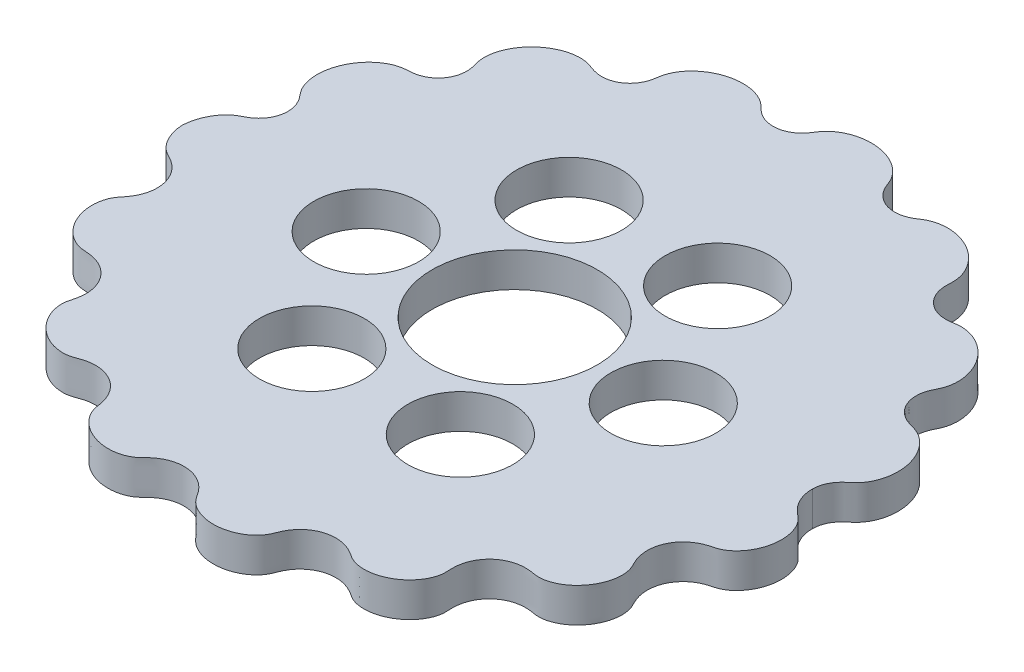
from build123d import *

# Parameters (mm, degrees)
CYCLOID_OUTLINE_R  = 12
CYCLOID_DEPTH      = 5
SKETCH9_R          = 7.62
CUT_EXTRUDE1_DEPTH = 70.412355435
OUTPUT_DRIVE_COUNT = 6


# Read off the part's stored shape, not the designer's step: cycloid
with BuildPart() as part:
    # cycloid outline → cycloid (new body)
    with BuildSketch(Plane(origin=(0, 0, 0), x_dir=(1, 0, 0), z_dir=(0, 1, 0))):
        with BuildLine():
            add(Edge.make_bspline(
                [(45.791143645, 0), (45.791044718, 0.035709067), (45.7917454, 0.091380476), (45.794361576, 0.182354533), (45.801877903, 0.319247109), (45.813231744, 0.451329802), (45.837194549, 0.642311191), (45.883740937, 0.900285738), (45.959121997, 1.195092859), (46.073392075, 1.524082435), (46.214825918, 1.842142476), (46.382081831, 2.147509859), (46.582505228, 2.451369448), (46.817612558, 2.750117995), (47.088232695, 3.039069345), (47.392300372, 3.317072034), (47.711650736, 3.576311705), (48.027967915, 3.839897493), (48.320841153, 4.129895992), (48.58665081, 4.444601084), (48.951399339, 4.95853426), (49.348576064, 5.71131862), (49.689762772, 6.727902698), (49.869417698, 8.005562584), (49.829972691, 9.246302695), (49.605704189, 10.417026119), (49.226622231, 11.495620562), (48.719669318, 12.466273191), (48.132222558, 13.270609136), (47.507180263, 13.911316119), (46.8808133, 14.401316598), (46.283614962, 14.756429936), (45.654719007, 15.020096062), (45.008969684, 15.174530662), (44.234761979, 15.402350458), (43.409252953, 15.8101144), (42.603395572, 16.482899511), (41.92645361, 17.493052272), (41.611196772, 18.50643566), (41.562738703, 19.44125351), (41.677366358, 20.18580286), (41.825605186, 20.696812098), (42.00265135, 21.135976255), (42.183918168, 21.509479821), (42.373360768, 21.878649615), (42.537443841, 22.260597058), (42.6655117, 22.655905781), (42.758985977, 23.060757489), (42.849842198, 23.676452052), (42.868905325, 24.507957446), (42.734142934, 25.540367974), (42.358867515, 26.730692622), (41.714976005, 27.997266086), (40.735039603, 29.260123841), (39.544875878, 30.245130523), (38.334912277, 30.855269674), (37.385546328, 31.134482617), (36.764100744, 31.239847338), (36.261122259, 31.27509466), (35.756618447, 31.257577158), (35.25840933, 31.181698295), (34.710386168, 31.088969133), (34.102125273, 31.044960795), (33.440153627, 31.087579768), (32.742765523, 31.252147132), (31.986481889, 31.574497619), (31.223605761, 32.108663374), (30.621752456, 32.800122521), (30.209550937, 33.593094839), (29.99181102, 34.327693461), (29.901841056, 34.963585281), (29.895682679, 35.62016809), (29.950101814, 36.28926429), (29.90707186, 36.977135893), (29.757972908, 37.664610893), (29.488647425, 38.422039871), (29.070419178, 39.225063385), (28.319934271, 40.26665126), (27.260260577, 41.242558266), (25.986370485, 42.016592634), (24.538812039, 42.527749499), (23.248352435, 42.743556926), (22.165810427, 42.720926624), (21.32642594, 42.564532639), (20.732315245, 42.370333258), (20.364365996, 42.21576588), (20.010858901, 42.030150625), (19.674617348, 41.815600126), (19.342479261, 41.595242791), (18.999155619, 41.391800088), (18.580987376, 41.184272563), (18.079096496, 40.997869123), (17.325688462, 40.828104465), (16.293627847, 40.819534903), (15.281758203, 41.100410913), (14.387736961, 41.65300335), (13.735964487, 42.297412034), (13.28985743, 42.928000082), (12.990493463, 43.5598319), (12.781474443, 44.148027847), (12.516068415, 44.71411016), (12.120084494, 45.343040797), (11.473988999, 46.063848156), (10.527769823, 46.785797808), (9.359701664, 47.370620769), (8.158950449, 47.729195176), (6.969488339, 47.886227379), (5.822922308, 47.865537325), (4.742364093, 47.689958888), (3.814520336, 47.392420218), (3.045616929, 47.023402249), (2.430665343, 46.627741452), (1.955464495, 46.243966915), (1.575671148, 45.853986374), (1.284809553, 45.475990371), (1.015548053, 45.060734846), (0.737655941, 44.628571167), (0.36381858, 44.157464682), (-0.218685603, 43.613854923), (-0.991222304, 43.13385172), (-1.855807766, 42.848037912), (-2.756661373, 42.774991225), (-3.539268391, 42.869190961), (-4.188453233, 43.05813635), (-4.737468758, 43.319195639), (-5.188923315, 43.613514971), (-5.554377122, 43.909610961), (-5.848423443, 44.184347472), (-6.131330185, 44.469984176), (-6.426996975, 44.743204379), (-6.825431917, 45.050840245), (-7.444374765, 45.424064462), (-8.31967903, 45.778767518), (-9.459419253, 46.016210564), (-10.740313551, 46.046431635), (-12.254098076, 45.823552513), (-13.662382924, 45.30474876), (-14.908460378, 44.533431706), (-15.846127765, 43.637091067), (-16.389723504, 42.939475585), (-16.771888517, 42.285735781), (-17.02334891, 41.70777756), (-17.202912579, 41.087866838), (-17.2871338, 40.437018518), (-17.410026413, 39.778486495), (-17.631028998, 39.129932573), (-18.004795115, 38.416404109), (-18.59276285, 37.695306532), (-19.461522858, 37.045468009), (-20.623810501, 36.62412397), (-21.664155971, 36.574710073), (-22.487225656, 36.726372796), (-23.06911051, 36.915204834), (-23.434316728, 37.054207293), (-23.80113819, 37.189273347), (-24.177886594, 37.294894855), (-24.562156743, 37.368129104), (-24.951019675, 37.410162996), (-25.55739949, 37.430205922), (-26.378973338, 37.35800464), (-27.392109583, 37.110467986), (-28.543247944, 36.60158969), (-29.596977368, 35.907866539), (-30.527645496, 35.050927684), (-31.309458297, 34.051525273), (-31.914640147, 32.9315255), (-32.273307057, 31.831746147), (-32.402238164, 30.902168997), (-32.389929735, 30.183917263), (-32.324947483, 29.687696324), (-32.238077344, 29.296870339), (-32.129285262, 28.912213863), (-32.031179018, 28.524392463), (-31.946966299, 28.064631448), (-31.903845038, 27.530982276), (-31.943398059, 26.760474547), (-32.190554324, 25.842313716), (-32.714817544, 24.917948279), (-33.481209481, 24.178457279), (-34.253889162, 23.721098076), (-35.002542732, 23.45663091), (-35.598626685, 23.344763324), (-36.115367878, 23.304592492), (-36.626191865, 23.278507298), (-37.1292901, 23.220268604), (-37.699375669, 23.0776625), (-38.320084607, 22.833367076), (-38.995099579, 22.470873459), (-39.69971468, 21.967809486), (-40.402168488, 21.305180913), (-41.062996496, 20.470830894), (-41.630941212, 19.503244791), (-42.073626181, 18.408903699), (-42.35315301, 17.201396977), (-42.424303809, 15.905331952), (-42.269791293, 14.732767422), (-41.970134291, 13.818812181), (-41.627168532, 13.164581306), (-41.332838925, 12.738529487), (-41.071193015, 12.417937603), (-40.809989045, 12.097322008), (-40.569539389, 11.760069455), (-40.230320456, 11.193034954), (-39.895615694, 10.342602983), (-39.759485299, 9.187768582), (-40.029405832, 7.989061184), (-40.526833986, 7.081313752), (-41.041941635, 6.490179056), (-41.45783409, 6.127908171), (-41.859352307, 5.849965992), (-42.228042358, 5.636093117), (-42.6076181, 5.44406246), (-42.982758423, 5.242108458), (-43.337612638, 5.005722135), (-43.669462177, 4.738439913), (-44.128050822, 4.299222902), (-44.65860929, 3.639917106), (-45.183869534, 2.721680093), (-45.57650409, 1.611292162), (-45.736769075, 0.766479031), (-45.787579333, 0.226535958), (-45.799999967, 0)],
                knots=[0.069754235, 0.069754235, 0.069754235, 0.069754235, 0.069754235, 0.070175714, 0.070396306, 0.070616899, 0.071058084, 0.071499269, 0.072381639, 0.073264009, 0.074146379, 0.075028749, 0.075911119, 0.076793489, 0.077837633, 0.078881776, 0.079925919, 0.080970062, 0.082014206, 0.083058349, 0.084102492, 0.085146635, 0.088403663, 0.09166069, 0.094917718, 0.098174745, 0.100943902, 0.103713058, 0.106482215, 0.109251371, 0.111010962, 0.112770552, 0.114530143, 0.116289733, 0.117895735, 0.119501737, 0.122713741, 0.12555991, 0.128406079, 0.131688402, 0.133329564, 0.134970725, 0.136023818, 0.13707691, 0.138130003, 0.139183096, 0.140236189, 0.141289282, 0.142342374, 0.143395467, 0.146547253, 0.14969904, 0.152850826, 0.156002612, 0.16090603, 0.165809448, 0.168364703, 0.169642331, 0.170919959, 0.172197586, 0.173475214, 0.174752841, 0.176030469, 0.177839633, 0.179648797, 0.181457961, 0.183267125, 0.186143212, 0.189019298, 0.190643252, 0.192267205, 0.193891159, 0.195515112, 0.197294847, 0.199074582, 0.200854317, 0.202634052, 0.20543312, 0.208232187, 0.213830323, 0.217132788, 0.220435253, 0.223737718, 0.227040183, 0.228051834, 0.229063485, 0.230075137, 0.231086788, 0.23209844, 0.233110091, 0.234121742, 0.235133394, 0.236832117, 0.23853084, 0.241928286, 0.245502499, 0.247289605, 0.249076711, 0.251188415, 0.253300118, 0.254355969, 0.255411821, 0.257523524, 0.260820311, 0.264117098, 0.267413885, 0.270710673, 0.273478645, 0.276246618, 0.279014591, 0.281782564, 0.283329452, 0.284876341, 0.28642323, 0.287970119, 0.288839148, 0.289708176, 0.291446234, 0.293184291, 0.294922348, 0.297763252, 0.300604156, 0.302312211, 0.304020267, 0.305728322, 0.307436377, 0.308456827, 0.309477276, 0.310497726, 0.311518176, 0.312538625, 0.313559075, 0.315599974, 0.318834626, 0.322069277, 0.325303928, 0.32853858, 0.334292828, 0.337169952, 0.340047076, 0.341643717, 0.343240358, 0.344837, 0.346433641, 0.348164668, 0.349895694, 0.351626721, 0.353357747, 0.356308074, 0.3592584, 0.362490099, 0.365721797, 0.366713328, 0.367704859, 0.36869639, 0.369687921, 0.370679452, 0.371670983, 0.372662514, 0.373654045, 0.376832204, 0.380010363, 0.383188522, 0.386366682, 0.389580806, 0.392794931, 0.396009056, 0.399223181, 0.401252378, 0.402266976, 0.403281575, 0.404296173, 0.405310772, 0.40632537, 0.407339968, 0.40903617, 0.410732371, 0.414124773, 0.416893634, 0.419662495, 0.421414751, 0.423167008, 0.424919264, 0.425795392, 0.42667152, 0.42836046, 0.4300494, 0.431738339, 0.433427279, 0.436119098, 0.438810917, 0.441502737, 0.444194556, 0.447470798, 0.450747041, 0.454023283, 0.457299526, 0.459398745, 0.460448355, 0.461497965, 0.462547575, 0.463597184, 0.464646794, 0.465696404, 0.469247721, 0.472799039, 0.476221715, 0.477933053, 0.47964439, 0.480724427, 0.481804463, 0.4828845, 0.483964536, 0.485044573, 0.486124609, 0.487204646, 0.488284682, 0.491482222, 0.494679762, 0.497877302, 0.500180084, 0.500180084, 0.500180084, 0.500180084, 0.500180084], degree=4))
            add(Edge.make_bspline(
                [(-45.799999967, 0), (-45.79994289, -0.001176845), (-45.797706044, -0.047007033), (-45.792165144, -0.138319864), (-45.778335118, -0.322360431), (-45.755957285, -0.521647896), (-45.719682859, -0.779542321), (-45.663685084, -1.086295004), (-45.560593365, -1.522696014), (-45.381062797, -2.07998477), (-45.146332671, -2.616974867), (-44.855642055, -3.125513667), (-44.566661368, -3.534266505), (-44.299891486, -3.853649118), (-44.002518772, -4.151019116), (-43.67369492, -4.420710551), (-43.318812861, -4.647176542), (-42.94815397, -4.835209345), (-42.499931907, -5.070066216), (-41.982745669, -5.385306707), (-41.417795583, -5.8250992), (-40.84902492, -6.424143728), (-40.375087555, -7.114193596), (-40.016758113, -7.872211418), (-39.784200405, -8.680490069), (-39.684988138, -9.51704417), (-39.72194129, -10.358813765), (-39.875306013, -11.095898244), (-40.09597401, -11.717858283), (-40.335524321, -12.212589636), (-40.558419237, -12.592680122), (-40.797510514, -12.940581298), (-41.043942069, -13.260643821), (-41.30461869, -13.573066388), (-41.552888179, -13.900545438), (-41.762324518, -14.258944198), (-41.934750723, -14.640038597), (-42.104344549, -15.135186458), (-42.281447401, -15.939581873), (-42.332636534, -17.081909036), (-42.081217853, -18.550322292), (-41.481146833, -19.918131768), (-40.727300038, -20.973081902), (-39.942645418, -21.737875274), (-39.237111942, -22.252659036), (-38.5895327, -22.58121606), (-38.04184596, -22.762320201), (-37.632290014, -22.843390019), (-37.375059269, -22.875839355), (-37.08537412, -22.896034229), (-36.764334851, -22.913319289), (-36.31695566, -22.949980911), (-35.718420378, -23.04240061), (-35.008389856, -23.23898588), (-34.222040468, -23.597252453), (-33.480873062, -24.101085891), (-32.834325658, -24.727010243), (-32.306386766, -25.452879984), (-31.909560988, -26.262297501), (-31.658498924, -27.125572321), (-31.560858193, -27.987145679), (-31.594396005, -28.725734163), (-31.693227525, -29.325566989), (-31.798862298, -29.763849702), (-31.884021272, -30.07520393), (-31.957926354, -30.357108161), (-32.010636384, -30.611804018), (-32.06671208, -31.026968818), (-32.071912634, -31.605861018), (-31.968226815, -32.327228618), (-31.705305142, -33.163349158), (-31.229297456, -34.154585333), (-30.467598059, -35.207545787), (-29.348865479, -36.223046091), (-28.013666276, -36.935490645), (-26.788971488, -37.276039577), (-25.829151793, -37.340798712), (-25.174937492, -37.283452417), (-24.647761287, -37.15418316), (-24.240535448, -37.000652934), (-23.748474167, -36.814638565), (-23.15453283, -36.63335479), (-22.437610567, -36.502568715), (-21.601477806, -36.47894749), (-20.766986641, -36.588159426), (-19.959561144, -36.830190879), (-19.181801043, -37.209281678), (-18.461206867, -37.725371511), (-17.826358851, -38.371672688), (-17.337546991, -39.086308818), (-16.994314931, -39.811961842), (-16.79678001, -40.438033383), (-16.688711132, -40.93747638), (-16.620330823, -41.358384728), (-16.569471677, -41.696868074), (-16.492060266, -42.060659215), (-16.367038483, -42.442232476), (-16.190604292, -42.834990471), (-15.960563846, -43.232871484), (-15.637881366, -43.689153429), (-15.201421536, -44.182849033), (-14.449901338, -44.849583948), (-13.301206178, -45.542335266), (-12.02736682, -45.974543482), (-10.697708799, -46.124450438), (-9.603770366, -46.052531067), (-8.748683057, -45.872068964), (-8.071025327, -45.609990555), (-7.569954129, -45.323483988), (-7.235793155, -45.072810345), (-7.039670951, -44.903039897), (-6.83084625, -44.701016807), (-6.602985859, -44.473898415), (-6.275949365, -44.16593631), (-5.80610579, -43.783163124), (-5.184097378, -43.387493712), (-4.390792896, -43.043633439), (-3.519684109, -42.831032687), (-2.62155744, -42.770671675), (-1.729012701, -42.865373528), (-0.862581898, -43.113273277), (-0.054003719, -43.505229709), (0.650581908, -44.009768249), (1.176142511, -44.529192128), (1.555096644, -45.00407772), (1.809697886, -45.375754205), (1.983911046, -45.647237154), (2.144001635, -45.89053761), (2.298172925, -46.099817042), (2.569425547, -46.418761725), (2.996294328, -46.809299523), (3.601706252, -47.214221735), (4.398741249, -47.577618756), (5.45340048, -47.88647141), (6.745336857, -48.024528593), (8.248615683, -47.872202567), (9.671634768, -47.356068935), (10.744466239, -46.672887926), (11.434725269, -46.002062206), (11.8295929, -45.476860541), (12.085777919, -44.998022741), (12.243922764, -44.592354615), (12.435271255, -44.102058872), (12.698564888, -43.539220546), (13.081942411, -42.918933381), (13.624924352, -42.281973867), (14.265566062, -41.735365221), (14.986691348, -41.29802325), (15.789513461, -40.974782328), (16.655449606, -40.785898661), (17.560248819, -40.74788517), (18.417706936, -40.8638546), (19.185877405, -41.095086807), (19.782652799, -41.367637277), (20.22566825, -41.621736325), (20.583912096, -41.852599853), (20.86939433, -42.041109629), (21.191610574, -42.226476203), (21.558809727, -42.38833643), (21.968628784, -42.519523785), (22.418040214, -42.614361462), (22.972748968, -42.679431009), (23.631288357, -42.685027121), (24.628971679, -42.572258294), (25.912000104, -42.181802995), (27.085338334, -41.524017945), (28.08634408, -40.635706235), (28.764882085, -39.773814867), (29.202754164, -39.016896239), (29.461064446, -38.337325493), (29.58292073, -37.772787357), (29.619728765, -37.35643584), (29.624475822, -37.09696046), (29.613874647, -36.806435391), (29.597617651, -36.484915638), (29.587863872, -36.035476479), (29.618378282, -35.429826389), (29.741419984, -34.702528562), (30.017884478, -33.882769424), (30.444069043, -33.093309073), (31.001369724, -32.386088373), (31.669872229, -31.787166095), (32.434327921, -31.310413056), (33.26667217, -30.973094985), (34.112829572, -30.788245387), (34.850126745, -30.746082621), (35.456199323, -30.782774217), (35.9024142, -30.842516499), (36.220511052, -30.894750105), (36.508289347, -30.938372315), (36.766858442, -30.963501801), (37.185161911, -30.974802441), (37.760613601, -30.918332948), (38.46606686, -30.738928966), (39.268761901, -30.389505496), (40.203165807, -29.812315366), (41.169734344, -28.944471415), (42.062115117, -27.725064735), (42.630386188, -26.321681009), (42.840041191, -25.066452803), (42.802670259, -24.104119845), (42.675919692, -23.459009563), (42.490734096, -22.948209809), (42.294692987, -22.559212713), (42.058478951, -22.088588823), (41.816670335, -21.515775084), (41.612814766, -20.815183077), (41.503651967, -19.984824645), (41.527196439, -19.142475062), (41.685924715, -18.313704688), (41.944206237, -17.609912532), (42.251805177, -17.033309933), (42.567662102, -16.575079465), (42.862445136, -16.219615404), (43.267891608, -15.81046193), (43.761356768, -15.4168424), (44.348414819, -15.061618623), (44.950145648, -14.801244987), (45.435269822, -14.642546395), (45.846370532, -14.531035892), (46.17729275, -14.444962057), (46.530306717, -14.329132305), (46.895873311, -14.164204008), (47.267136375, -13.94717862), (47.637865503, -13.67651335), (48.056869255, -13.307745919), (48.50111571, -12.822130054), (49.084142568, -12.005466257), (49.65195523, -10.790798283), (49.947841126, -9.478628896), (49.957060959, -8.140095153), (49.769973694, -7.058579641), (49.499814163, -6.226362277), (49.166937988, -5.57954675), (48.828256698, -5.111311526), (48.542926141, -4.805546029), (48.352957813, -4.628541279), (48.129711586, -4.44205656), (47.879773197, -4.238810514), (47.53919472, -3.944893637), (47.109643146, -3.516285276), (46.722098032, -3.02615449), (46.393134149, -2.476153552), (46.162080575, -1.967624909), (46.030759604, -1.597253124), (45.941546524, -1.273961104), (45.882909011, -1.001455893), (45.845321506, -0.781875857), (45.82073943, -0.586142711), (45.805639455, -0.421782166), (45.797105875, -0.280458306), (45.792732567, -0.159833788), (45.791260943, -0.072174943), (45.791047642, -0.024121236), (45.791143645, 0)],
                knots=[0.068872794, 0.068872794, 0.068872794, 0.068872794, 0.068872794, 0.06890049, 0.069951241, 0.071001992, 0.072052743, 0.073103494, 0.075204996, 0.077306498, 0.081117678, 0.084928859, 0.087030412, 0.089131965, 0.091233519, 0.093335073, 0.095525601, 0.09771613, 0.099727404, 0.101738678, 0.105761226, 0.109949892, 0.114157838, 0.118380335, 0.122621749, 0.12683599, 0.131095581, 0.135345634, 0.139589587, 0.141999518, 0.144409448, 0.146450816, 0.148492184, 0.150533552, 0.15257492, 0.154683639, 0.156792358, 0.15890806, 0.161023763, 0.165255083, 0.173408697, 0.181865198, 0.190863352, 0.195162347, 0.199461341, 0.203958508, 0.208464348, 0.209774543, 0.211084737, 0.212394932, 0.213705126, 0.215646703, 0.21758828, 0.221471433, 0.225937657, 0.230493466, 0.234984604, 0.2395099, 0.244050014, 0.24855716, 0.253127836, 0.257604838, 0.261505466, 0.263455781, 0.265406095, 0.266720518, 0.268034941, 0.269349364, 0.270663787, 0.275185672, 0.279698926, 0.284012919, 0.288326912, 0.29735649, 0.305810171, 0.314263866, 0.318630041, 0.322861658, 0.32517738, 0.327493102, 0.329574924, 0.331656747, 0.335820392, 0.340034151, 0.344262214, 0.34850693, 0.352770959, 0.357009089, 0.361686179, 0.366347835, 0.37099937, 0.374431875, 0.377864381, 0.379595163, 0.381325946, 0.383056729, 0.384787512, 0.387108859, 0.389430205, 0.391749577, 0.394068948, 0.398398402, 0.402727856, 0.412005049, 0.421008425, 0.425309932, 0.429611439, 0.434111087, 0.438619758, 0.439930585, 0.441241412, 0.44255224, 0.443863067, 0.44580617, 0.447749272, 0.451635477, 0.45610354, 0.460661837, 0.465155632, 0.469683399, 0.474221043, 0.47872551, 0.483293718, 0.487768967, 0.491666825, 0.493615754, 0.495564684, 0.496878302, 0.49819192, 0.499505539, 0.500819157, 0.505338598, 0.509849003, 0.514160517, 0.518472031, 0.527496341, 0.535954712, 0.544413048, 0.548781769, 0.553015651, 0.555332431, 0.557649211, 0.559732077, 0.561814944, 0.565980676, 0.570198011, 0.574428194, 0.578675537, 0.582941873, 0.587182135, 0.591856561, 0.596515541, 0.601163387, 0.60459394, 0.608024493, 0.609754351, 0.611484209, 0.613214068, 0.614943926, 0.6172638, 0.619583674, 0.621901655, 0.624219637, 0.62854648, 0.632873323, 0.642144901, 0.651153498, 0.655457516, 0.659761534, 0.664263654, 0.668775287, 0.670086749, 0.671398211, 0.672709673, 0.674021135, 0.675965736, 0.677910337, 0.681799539, 0.686269424, 0.690830205, 0.695326662, 0.699856898, 0.704392074, 0.708893866, 0.713459602, 0.71793308, 0.72182811, 0.723775625, 0.72572314, 0.727035997, 0.728348854, 0.729661711, 0.730974568, 0.735491538, 0.739999085, 0.744308118, 0.748617151, 0.757636192, 0.766099263, 0.774562224, 0.778933481, 0.783169607, 0.785487483, 0.787805359, 0.789889261, 0.791973164, 0.796140969, 0.80036186, 0.804594167, 0.808844134, 0.813112772, 0.817355166, 0.819691048, 0.82202693, 0.824355083, 0.826683237, 0.831327381, 0.834755947, 0.838184512, 0.839913479, 0.841642446, 0.843371413, 0.845100379, 0.847418766, 0.849737153, 0.852053739, 0.854370326, 0.858694557, 0.863018788, 0.872284753, 0.881298571, 0.885605098, 0.889911625, 0.894416305, 0.898930778, 0.900242916, 0.901555054, 0.902867193, 0.904179331, 0.906125403, 0.908071475, 0.911963619, 0.916435309, 0.91871694, 0.92099857, 0.923248131, 0.924372912, 0.925497692, 0.926630869, 0.927764045, 0.928330634, 0.928897222, 0.92946381, 0.930030398, 0.930030398, 0.930030398, 0.930030398, 0.930030398], degree=4))
        make_face()
        with Locations((2.54, 0)):
            Circle(CYCLOID_OUTLINE_R, mode=Mode.SUBTRACT)
    extrude(amount=CYCLOID_DEPTH)

    # Sketch9 → Cut-Extrude1 (cut, through all)
    with BuildSketch(Plane(origin=(0, 5, 0), x_dir=(1, 0, 0), z_dir=(0, 1, 0))):
        with Locations(Location((24.13, 0, 0), (0, 0, 270))):
            Circle(SKETCH9_R)
    cut_extrude1 = extrude(amount=-CUT_EXTRUDE1_DEPTH, mode=Mode.SUBTRACT)

    # output drive: Cut-Extrude1 ×6 about axis
    output_drive_axis = Axis((2.54, 0, 0), (0, 1, 0))
    for i in range(1, OUTPUT_DRIVE_COUNT):
        add(cut_extrude1.rotate(output_drive_axis, i * 360 / OUTPUT_DRIVE_COUNT), mode=Mode.SUBTRACT)


solid = part.part
